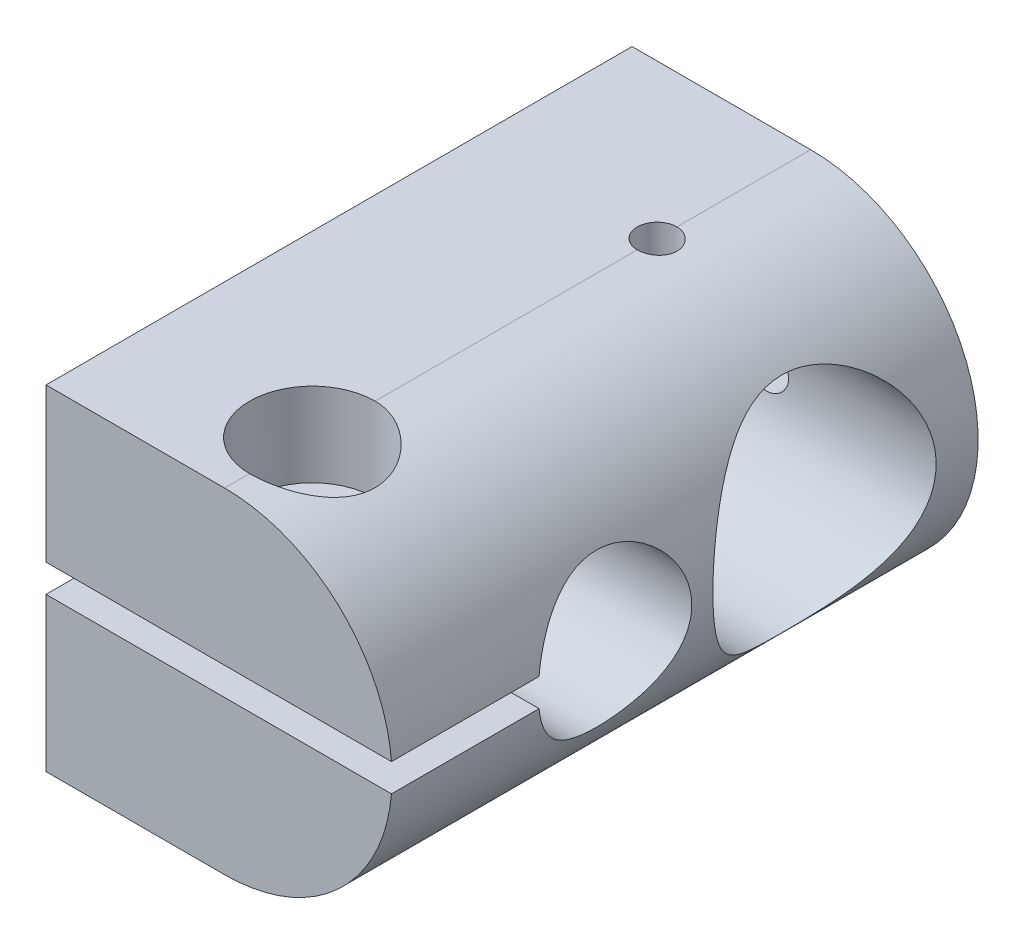
from build123d import *

# Parameters (mm, degrees)
SKETCH1_W              = 9.525
SKETCH1_H              = 33.3375
COMBINE1_START         = -165.1
COMBINE1_OUTLINE_R     = 6.35
COMBINE1_DEPTH         = 17.1
COMBINE1_START_2       = -168.91
COMBINE1_2_OUTLINE_R   = 5.159375
COMBINE1_2_DEPTH       = 3.81
COMBINE1_3_OUTLINE_R   = 6.35
COMBINE1_3_DEPTH       = 10.107803
COMBINE1_4_OUTLINE_R   = 6.35
COMBINE1_4_OUTLINE_R_2 = 5.159375
COMBINE1_4_DEPTH       = 3.81
COMBINE1_START_3       = 4.7625
COMBINE1_5_OUTLINE_R   = 3.571875
COMBINE1_5_OUTLINE_R_2 = 1.1303
COMBINE1_5_DEPTH       = 4.7625
COMBINE1_START_4       = -11
COMBINE1_6_OUTLINE_R   = 1.7272
COMBINE1_6_OUTLINE_R_2 = 1.1303
COMBINE1_6_DEPTH       = 15.7625
COMBINE1_START_5       = 0.793749963
COMBINE1_7_OUTLINE_R   = 2.1844
COMBINE1_7_OUTLINE_R_2 = 1.7272
COMBINE1_7_DEPTH       = 3.968750037
COMBINE1_START_6       = -33.3375
COMBINE1_8_OUTLINE_R   = 1.1303
COMBINE1_8_DEPTH       = 2.48900636


with BuildPart() as part:
    # Sketch1 → Revolve1 (revolve)
    with BuildSketch(Plane(origin=(0, 0, 0), x_dir=(1, 0, 0), z_dir=(0, 1, 0))):
        with Locations((-153.9875, 16.66875)):
            Rectangle(SKETCH1_W, SKETCH1_H)
    revolve(axis=Axis((-158.75, 0, 0), (0, 0, -1)))

    # Combine1: read off the stored shape, not the designer's step
    # Combine1 outline → Combine1 (cut)
    with BuildSketch(Plane.YZ.offset(COMBINE1_START)):
        with BuildLine():
            Line((0.79375, 0), (-0.79375, 0))
            Line((-0.79375, 0), (-0.793749936, -8.394440501))
            ThreePointArc((-0.793749936, -8.394440501), (-1e-08, -17.052925), (0.793749959, -8.394440505))
            Line((0.793749959, -8.394440505), (0.79375, 0))
        make_face()
        with Locations((0, -24.5999)):
            Circle(COMBINE1_OUTLINE_R)
    extrude(amount=COMBINE1_DEPTH, mode=Mode.SUBTRACT)

    # Combine1 2 outline → Combine1 2 (cut)
    with BuildSketch(Plane.YZ.offset(COMBINE1_START_2)):
        with BuildLine():
            Line((0.79375, 0), (-0.79375, 0))
            Line((-0.79375, 0), (-0.793749936, -8.394440501))
            ThreePointArc((-0.793749936, -8.394440501), (-1e-08, -17.052925), (0.793749959, -8.394440505))
            Line((0.793749959, -8.394440505), (0.79375, 0))
        make_face()
        with Locations((0, -24.5999)):
            Circle(COMBINE1_2_OUTLINE_R)
    extrude(amount=COMBINE1_2_DEPTH, mode=Mode.SUBTRACT)

    # Combine1 3 outline → Combine1 3 (add)
    with BuildSketch(Plane.YZ.offset(COMBINE1_START_2)):
        with BuildLine():
            Line((-0.79375, 0), (-9.525, 0))
            Line((-9.525, 0), (-9.525, -33.3375))
            Line((-9.525, -33.3375), (9.525, -33.3375))
            Line((9.525, -33.3375), (9.525, 0))
            Line((9.525, 0), (0.79375, 0))
            Line((0.79375, 0), (0.793749959, -8.394440505))
            ThreePointArc((0.793749959, -8.394440505), (-1e-08, -17.052925), (-0.793749936, -8.394440501))
            Line((-0.793749936, -8.394440501), (-0.79375, 0))
        make_face()
        with Locations((0, -24.5999)):
            Circle(COMBINE1_3_OUTLINE_R, mode=Mode.SUBTRACT)
    extrude(amount=COMBINE1_3_DEPTH)

    # Combine1 4 outline → Combine1 4 (add)
    with BuildSketch(Plane.YZ.offset(COMBINE1_START_2)):
        with Locations((0, -24.5999)):
            Circle(COMBINE1_4_OUTLINE_R)
        with Locations((0, -24.5999)):
            Circle(COMBINE1_4_OUTLINE_R_2, mode=Mode.SUBTRACT)
    extrude(amount=COMBINE1_4_DEPTH)

    # Combine1 5 outline → Combine1 5 (cut)
    with BuildSketch(Plane(origin=(0, 0, 0), x_dir=(1, 0, 0), z_dir=(0, 1, 0)).offset(COMBINE1_START_3)):
        with Locations((-158.75, 4.9911)):
            Circle(COMBINE1_5_OUTLINE_R)
        with Locations((-158.75, 24.5999)):
            Circle(COMBINE1_5_OUTLINE_R_2)
    extrude(amount=COMBINE1_5_DEPTH, mode=Mode.SUBTRACT)

    # Combine1 6 outline → Combine1 6 (cut)
    with BuildSketch(Plane(origin=(0, 0, 0), x_dir=(1, 0, 0), z_dir=(0, 1, 0)).offset(COMBINE1_START_4)):
        with Locations((-158.75, 4.9911)):
            Circle(COMBINE1_6_OUTLINE_R)
        with Locations((-158.75, 24.5999)):
            Circle(COMBINE1_6_OUTLINE_R_2)
    extrude(amount=COMBINE1_6_DEPTH, mode=Mode.SUBTRACT)

    # Combine1 7 outline → Combine1 7 (cut)
    with BuildSketch(Plane(origin=(0, 0, 0), x_dir=(1, 0, 0), z_dir=(0, 1, 0)).offset(COMBINE1_START_5)):
        with Locations((-158.75, 4.9911)):
            Circle(COMBINE1_7_OUTLINE_R)
        with Locations((-158.75, 4.9911)):
            Circle(COMBINE1_7_OUTLINE_R_2, mode=Mode.SUBTRACT)
    extrude(amount=COMBINE1_7_DEPTH, mode=Mode.SUBTRACT)

    # Combine1 8 outline → Combine1 8 (cut)
    with BuildSketch(Plane.XY.offset(COMBINE1_START_6)):
        with Locations((-158.75, 0)):
            Circle(COMBINE1_8_OUTLINE_R)
    extrude(amount=COMBINE1_8_DEPTH, mode=Mode.SUBTRACT)


solid = part.part
